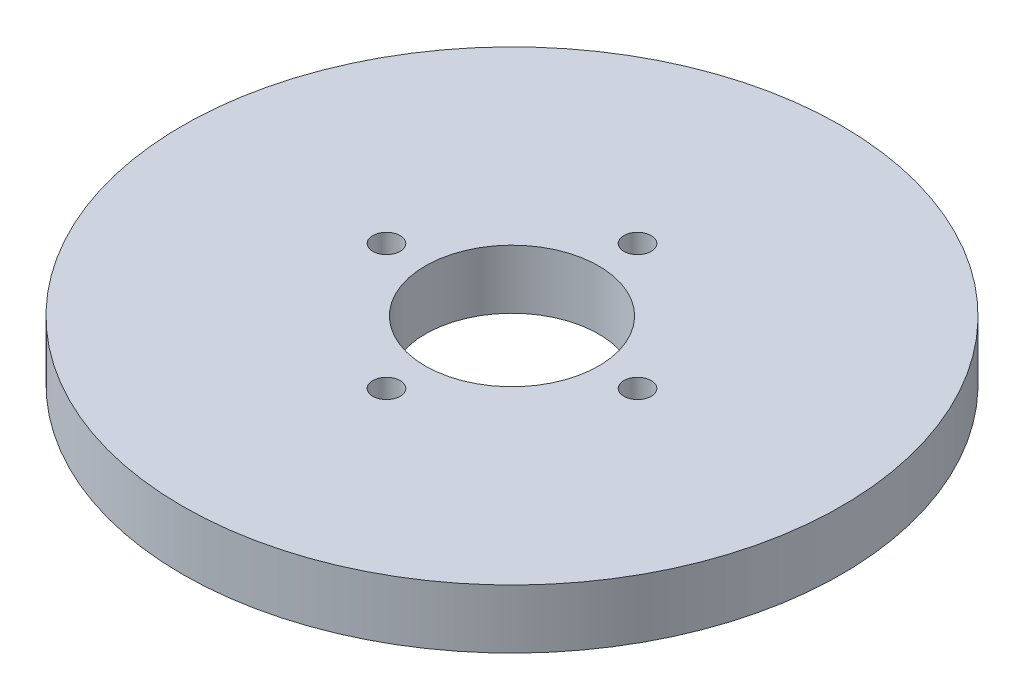
from build123d import *

# Parameters (mm, degrees)
SKETCH1_R           = 95
BOSS_EXTRUDE1_DEPTH = 17
SKETCH2_R           = 25
CUT_EXTRUDE1_DEPTH  = 136.421564014
SKETCH3_R           = 3.944434484
CUT_EXTRUDE2_DEPTH  = 15.776308666
CIRPATTERN1_COUNT   = 4


with BuildPart() as part:
    # Sketch1 → Boss-Extrude1 (new body)
    with BuildSketch(Plane(origin=(0, 0, 0), x_dir=(1, 0, 0), z_dir=(0, 1, 0))):
        Circle(SKETCH1_R)
    extrude(amount=BOSS_EXTRUDE1_DEPTH)

    # Sketch2 → Cut-Extrude1 (cut, through all)
    with BuildSketch(Plane(origin=(0, 0, 0), x_dir=(1, 0, 0), z_dir=(0, 1, 0))):
        Circle(SKETCH2_R)
    extrude(amount=CUT_EXTRUDE1_DEPTH, mode=Mode.SUBTRACT)

    # Sketch3 → Cut-Extrude2 (cut)
    with BuildSketch(Plane(origin=(0, 17, 0), x_dir=(1, 0, 0), z_dir=(0, 1, 0))):
        with Locations((-36.185966833, 0)):
            Circle(SKETCH3_R)
    cut_extrude2 = extrude(amount=-CUT_EXTRUDE2_DEPTH, mode=Mode.SUBTRACT)

    # CirPattern1: Cut-Extrude2 ×4 about axis
    cirpattern1_axis = Axis((0, 0, 0), (0, 1, 0))
    for i in range(1, CIRPATTERN1_COUNT):
        add(cut_extrude2.rotate(cirpattern1_axis, i * 360 / CIRPATTERN1_COUNT), mode=Mode.SUBTRACT)


solid = part.part
